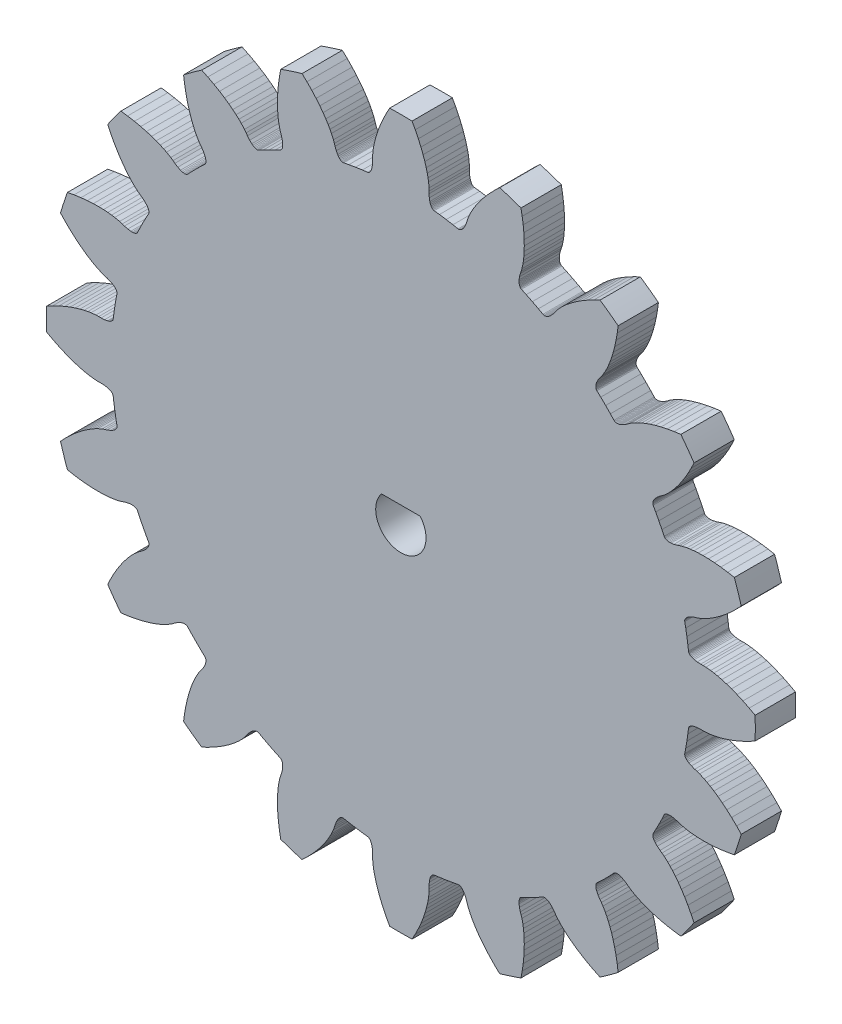
from build123d import *

# Parameters (mm, degrees)
MODEL_R             = 0.5
BOSS_EXTRUDE1_DEPTH = 5
CUT_EXTRUDE1_DEPTH  = 63.425869445
BOSS_EXTRUDE2_START = 10
SKETCH3_R           = 8
BOSS_EXTRUDE2_DEPTH = 10
SKETCH5_R           = 1.5
CUT_EXTRUDE2_DEPTH  = 10


with BuildPart() as part:
    # Model → Boss-Extrude1 (new body)
    with BuildSketch(Plane.XY):
        with BuildLine():
            Line((41.0580513, 11.0594647), (41.6786239, 11.6621942))
            Line((41.6786239, 11.6621942), (42.254799591, 12.268924064))
            ThreePointArc((42.254799591, 12.268924064), (41.846428175, 13.596728691), (41.396343585, 14.910979886))
            Line((41.396343585, 14.910979886), (40.5735808, 15.0631672))
            Line((40.5735808, 15.0631672), (39.7172515, 15.1860222))
            Line((39.7172515, 15.1860222), (38.9209581, 15.2664261))
            Line((38.9209581, 15.2664261), (38.188074, 15.3095207))
            Line((38.188074, 15.3095207), (37.5212498, 15.3207867))
            Line((37.5212498, 15.3207867), (36.9192091, 15.3057692))
            Line((36.9192091, 15.3057692), (36.385219, 15.2700607))
            Line((36.385219, 15.2700607), (35.9182805, 15.2191681))
            Line((35.9182805, 15.2191681), (35.519022, 15.1586865))
            Line((35.519022, 15.1586865), (34.9229912, 15.031255))
            Line((34.9229912, 15.031255), (34.5912709, 14.9315723))
            Line((34.5912709, 14.9315723), (34.3145829, 14.8346777))
            Line((34.3145829, 14.8346777), (33.8996768, 14.7245961))
            Line((33.8996768, 14.7245961), (33.5375203, 14.6729516))
            Line((33.5375203, 14.6729516), (33.3775076, 14.6675821))
            Line((33.3775076, 14.6675821), (33.232174, 14.6750343))
            Line((33.232174, 14.6750343), (33.1019936, 14.6947079))
            Line((33.1019936, 14.6947079), (32.9874095, 14.7259534))
            Line((32.9874095, 14.7259534), (32.8888203, 14.7681208))
            Line((32.8888203, 14.7681208), (32.8066469, 14.8205604))
            Line((32.8066469, 14.8205604), (32.74127, 14.8825908))
            Line((32.74127, 14.8825908), (32.6837041, 14.9725741))
            Line((32.6837041, 14.9725741), (32.4071065, 15.5624769))
            Line((32.4071065, 15.5624769), (32.0316845, 16.3209585))
            Line((32.0316845, 16.3209585), (31.6387276, 17.0705055))
            Line((31.6387276, 17.0705055), (31.3240661, 17.6410139))
            Line((31.3240661, 17.6410139), (31.2851045, 17.7404764))
            Line((31.2851045, 17.7404764), (31.2733484, 17.829828))
            Line((31.2733484, 17.829828), (31.2792242, 17.927131))
            Line((31.2792242, 17.927131), (31.3030593, 18.0316767))
            Line((31.3030593, 18.0316767), (31.345132, 18.1427428))
            Line((31.345132, 18.1427428), (31.4057339, 18.2596248))
            Line((31.4057339, 18.2596248), (31.48513, 18.3815824))
            Line((31.48513, 18.3815824), (31.583527, 18.5078793))
            Line((31.583527, 18.5078793), (31.8381786, 18.7705142))
            Line((31.8381786, 18.7705142), (32.1711122, 19.0414759))
            Line((32.1711122, 19.0414759), (32.4121346, 19.208368))
            Line((32.4121346, 19.208368), (32.6877599, 19.4181434))
            Line((32.6877599, 19.4181434), (33.1411923, 19.8254401))
            Line((33.1411923, 19.8254401), (33.4248012, 20.1128967))
            Line((33.4248012, 20.1128967), (33.7404338, 20.460744))
            Line((33.7404338, 20.460744), (34.083194, 20.8717622))
            Line((34.083194, 20.8717622), (34.4492141, 21.3499962))
            Line((34.4492141, 21.3499962), (34.8320491, 21.8960904))
            Line((34.8320491, 21.8960904), (35.2279633, 22.5143365))
            Line((35.2279633, 22.5143365), (35.6309647, 23.2058115))
            Line((35.6309647, 23.2058115), (36.0349107, 23.9708089))
            Line((36.0349107, 23.9708089), (36.395396459, 24.725891411))
            ThreePointArc((36.395396459, 24.725891411), (35.596697995, 25.862514918), (34.762516187, 26.973358268))
            Line((34.762516187, 26.973358268), (33.9329938, 26.8638493))
            Line((33.9329938, 26.8638493), (33.0806119, 26.716071))
            Line((33.0806119, 26.716071), (32.2984457, 26.5464715))
            Line((32.2984457, 26.5464715), (31.5881145, 26.3609832))
            Line((31.5881145, 26.3609832), (30.9504457, 26.1656379))
            Line((30.9504457, 26.1656379), (30.3825116, 25.9653146))
            Line((30.3825116, 25.9653146), (29.8856913, 25.7663418))
            Line((29.8856913, 25.7663418), (29.4573331, 25.5736481))
            Line((29.4573331, 25.5736481), (29.0963056, 25.392749))
            Line((29.0963056, 25.392749), (28.5688252, 25.0873708))
            Line((28.5688252, 25.0873708), (28.284144, 24.8900597))
            Line((28.284144, 24.8900597), (28.0509402, 24.7124062))
            Line((28.0509402, 24.7124062), (27.6903581, 24.4794994))
            Line((27.6903581, 24.4794994), (27.3618858, 24.3184699))
            Line((27.3618858, 24.3184699), (27.211364, 24.2639166))
            Line((27.211364, 24.2639166), (27.0708407, 24.2260935))
            Line((27.0708407, 24.2260935), (26.9409522, 24.2045762))
            Line((26.9409522, 24.2045762), (26.8223209, 24.198884))
            Line((26.8223209, 24.198884), (26.7155266, 24.2085219))
            Line((26.7155266, 24.2085219), (26.6211702, 24.2330019))
            Line((26.6211702, 24.2330019), (26.5398247, 24.2717938))
            Line((26.5398247, 24.2717938), (26.45727, 24.3395841))
            Line((26.45727, 24.3395841), (26.01192, 24.8151417))
            Line((26.01192, 24.8151417), (25.4204888, 25.4204888))
            Line((25.4204888, 25.4204888), (24.8151417, 26.01192))
            Line((24.8151417, 26.01192), (24.3395841, 26.45727))
            Line((24.3395841, 26.45727), (24.2717938, 26.5398247))
            Line((24.2717938, 26.5398247), (24.2330019, 26.6211702))
            Line((24.2330019, 26.6211702), (24.2085219, 26.7155266))
            Line((24.2085219, 26.7155266), (24.198884, 26.8223209))
            Line((24.198884, 26.8223209), (24.2045762, 26.9409522))
            Line((24.2045762, 26.9409522), (24.2260935, 27.0708407))
            Line((24.2260935, 27.0708407), (24.2639166, 27.211364))
            Line((24.2639166, 27.211364), (24.3184699, 27.3618858))
            Line((24.3184699, 27.3618858), (24.4794994, 27.6903581))
            Line((24.4794994, 27.6903581), (24.7124062, 28.0509402))
            Line((24.7124062, 28.0509402), (24.8900597, 28.284144))
            Line((24.8900597, 28.284144), (25.0873708, 28.5688252))
            Line((25.0873708, 28.5688252), (25.392749, 29.0963056))
            Line((25.392749, 29.0963056), (25.5736481, 29.4573331))
            Line((25.5736481, 29.4573331), (25.7663418, 29.8856913))
            Line((25.7663418, 29.8856913), (25.9653146, 30.3825116))
            Line((25.9653146, 30.3825116), (26.1656379, 30.9504457))
            Line((26.1656379, 30.9504457), (26.3609832, 31.5881145))
            Line((26.3609832, 31.5881145), (26.5464715, 32.2984457))
            Line((26.5464715, 32.2984457), (26.716071, 33.0806119))
            Line((26.716071, 33.0806119), (26.8638493, 33.9329938))
            Line((26.8638493, 33.9329938), (26.973358307, 34.762516234))
            ThreePointArc((26.973358307, 34.762516234), (25.862514956, 35.59669804), (24.725891448, 36.395396503))
            Line((24.725891448, 36.395396503), (23.9708089, 36.0349107))
            Line((23.9708089, 36.0349107), (23.2058115, 35.6309647))
            Line((23.2058115, 35.6309647), (22.5143365, 35.2279633))
            Line((22.5143365, 35.2279633), (21.8960904, 34.8320491))
            Line((21.8960904, 34.8320491), (21.3499962, 34.4492141))
            Line((21.3499962, 34.4492141), (20.8717622, 34.083194))
            Line((20.8717622, 34.083194), (20.460744, 33.7404338))
            Line((20.460744, 33.7404338), (20.1128967, 33.4248012))
            Line((20.1128967, 33.4248012), (19.8254401, 33.1411923))
            Line((19.8254401, 33.1411923), (19.4181434, 32.6877599))
            Line((19.4181434, 32.6877599), (19.208368, 32.4121346))
            Line((19.208368, 32.4121346), (19.0414759, 32.1711122))
            Line((19.0414759, 32.1711122), (18.7705142, 31.8381786))
            Line((18.7705142, 31.8381786), (18.5078793, 31.583527))
            Line((18.5078793, 31.583527), (18.3815824, 31.48513))
            Line((18.3815824, 31.48513), (18.2596248, 31.4057339))
            Line((18.2596248, 31.4057339), (18.1427428, 31.345132))
            Line((18.1427428, 31.345132), (18.0316767, 31.3030593))
            Line((18.0316767, 31.3030593), (17.927131, 31.2792242))
            Line((17.927131, 31.2792242), (17.829828, 31.2733484))
            Line((17.829828, 31.2733484), (17.7404764, 31.2851045))
            Line((17.7404764, 31.2851045), (17.6410139, 31.3240661))
            Line((17.6410139, 31.3240661), (17.0705055, 31.6387276))
            Line((17.0705055, 31.6387276), (16.3209585, 32.0316845))
            Line((16.3209585, 32.0316845), (15.5624769, 32.4071065))
            Line((15.5624769, 32.4071065), (14.9725741, 32.6837041))
            Line((14.9725741, 32.6837041), (14.8825908, 32.74127))
            Line((14.8825908, 32.74127), (14.8205604, 32.8066469))
            Line((14.8205604, 32.8066469), (14.7681208, 32.8888203))
            Line((14.7681208, 32.8888203), (14.7259534, 32.9874095))
            Line((14.7259534, 32.9874095), (14.6947079, 33.1019936))
            Line((14.6947079, 33.1019936), (14.6750343, 33.232174))
            Line((14.6750343, 33.232174), (14.6675821, 33.3775076))
            Line((14.6675821, 33.3775076), (14.6729516, 33.5375203))
            Line((14.6729516, 33.5375203), (14.7245961, 33.8996768))
            Line((14.7245961, 33.8996768), (14.8346777, 34.3145829))
            Line((14.8346777, 34.3145829), (14.9315723, 34.5912709))
            Line((14.9315723, 34.5912709), (15.031255, 34.9229912))
            Line((15.031255, 34.9229912), (15.1586865, 35.519022))
            Line((15.1586865, 35.519022), (15.2191681, 35.9182805))
            Line((15.2191681, 35.9182805), (15.2700607, 36.385219))
            Line((15.2700607, 36.385219), (15.3057692, 36.9192091))
            Line((15.3057692, 36.9192091), (15.3207867, 37.5212498))
            Line((15.3207867, 37.5212498), (15.3095207, 38.188074))
            Line((15.3095207, 38.188074), (15.2664261, 38.9209581))
            Line((15.2664261, 38.9209581), (15.1860222, 39.7172515))
            Line((15.1860222, 39.7172515), (15.0631672, 40.5735808))
            Line((15.0631672, 40.5735808), (14.910979886, 41.396343585))
            ThreePointArc((14.910979886, 41.396343585), (13.596728691, 41.846428175), (12.268924064, 42.254799591))
            Line((12.268924064, 42.254799591), (11.6621942, 41.6786239))
            Line((11.6621942, 41.6786239), (11.0594647, 41.0580513))
            Line((11.0594647, 41.0580513), (10.5263671, 40.4610966))
            Line((10.5263671, 40.4610966), (10.0607243, 39.8935113))
            Line((10.0607243, 39.8935113), (9.6596604, 39.3606612))
            Line((9.6596604, 39.3606612), (9.3179393, 38.864773))
            Line((9.3179393, 38.864773), (9.0329565, 38.411777))
            Line((9.0329565, 38.411777), (8.7996699, 38.0041019))
            Line((8.7996699, 38.0041019), (8.6139223, 37.6455448))
            Line((8.6139223, 37.6455448), (8.3666785, 37.0884434))
            Line((8.3666785, 37.0884434), (8.2523431, 36.761484))
            Line((8.2523431, 36.761484), (8.1680994, 36.4806855))
            Line((8.1680994, 36.4806855), (8.0132816, 36.0803151))
            Line((8.0132816, 36.0803151), (7.8421926, 35.7569684))
            Line((7.8421926, 35.7569684), (7.7524835, 35.6243594))
            Line((7.7524835, 35.6243594), (7.6610297, 35.5111623))
            Line((7.6610297, 35.5111623), (7.5685952, 35.4174079))
            Line((7.5685952, 35.4174079), (7.4759663, 35.3430731))
            Line((7.4759663, 35.3430731), (7.3839029, 35.2880982))
            Line((7.3839029, 35.2880982), (7.293178, 35.2524417))
            Line((7.293178, 35.2524417), (7.2045667, 35.2360112))
            Line((7.2045667, 35.2360112), (7.0979324, 35.2423303))
            Line((7.0979324, 35.2423303), (6.458111, 35.3652943))
            Line((6.458111, 35.3652943), (5.623819, 35.5073958))
            Line((5.623819, 35.5073958), (4.7864484, 35.6300597))
            Line((4.7864484, 35.6300597), (4.1399441, 35.7108296))
            Line((4.1399441, 35.7108296), (4.0365761, 35.7377716))
            Line((4.0365761, 35.7377716), (3.9573791, 35.7807803))
            Line((3.9573791, 35.7807803), (3.8821131, 35.8427272))
            Line((3.8821131, 35.8427272), (3.8115438, 35.9234606))
            Line((3.8115438, 35.9234606), (3.7464191, 36.0227811))
            Line((3.7464191, 36.0227811), (3.6874804, 36.1405106))
            Line((3.6874804, 36.1405106), (3.6354825, 36.2764283))
            Line((3.6354825, 36.2764283), (3.5911425, 36.4302686))
            Line((3.5911425, 36.4302686), (3.5283469, 36.790659))
            Line((3.5283469, 36.790659), (3.5048276, 37.2192752))
            Line((3.5048276, 37.2192752), (3.5114786, 37.5123632))
            Line((3.5114786, 37.5123632), (3.5037752, 37.8586516))
            Line((3.5037752, 37.8586516), (3.4407861, 38.4648891))
            Line((3.4407861, 38.4648891), (3.37493, 38.8632963))
            Line((3.37493, 38.8632963), (3.2790398, 39.3231079))
            Line((3.2790398, 39.3231079), (3.1479885, 39.8419972))
            Line((3.1479885, 39.8419972), (2.9762302, 40.4192126))
            Line((2.9762302, 40.4192126), (2.7594555, 41.0499187))
            Line((2.7594555, 41.0499187), (2.4919965, 41.7336159))
            Line((2.4919965, 41.7336159), (2.1694597, 42.4660898))
            Line((2.1694597, 42.4660898), (1.7879973, 43.2425431))
            Line((1.7879973, 43.2425431), (1.389010873, 43.978008589))
            ThreePointArc((1.389010873, 43.978008589), (-7.7e-08, 43.9999385), (-1.389011027, 43.978008585))
            Line((-1.389011027, 43.978008585), (-1.7879973, 43.2425431))
            Line((-1.7879973, 43.2425431), (-2.1694597, 42.4660898))
            Line((-2.1694597, 42.4660898), (-2.4919965, 41.7336159))
            Line((-2.4919965, 41.7336159), (-2.7594555, 41.0499187))
            Line((-2.7594555, 41.0499187), (-2.9762302, 40.4192126))
            Line((-2.9762302, 40.4192126), (-3.1479885, 39.8419972))
            Line((-3.1479885, 39.8419972), (-3.2790398, 39.3231079))
            Line((-3.2790398, 39.3231079), (-3.37493, 38.8632963))
            Line((-3.37493, 38.8632963), (-3.4407861, 38.4648891))
            Line((-3.4407861, 38.4648891), (-3.5037752, 37.8586516))
            Line((-3.5037752, 37.8586516), (-3.5114786, 37.5123632))
            Line((-3.5114786, 37.5123632), (-3.5048276, 37.2192752))
            Line((-3.5048276, 37.2192752), (-3.5283469, 36.790659))
            Line((-3.5283469, 36.790659), (-3.5911425, 36.4302686))
            Line((-3.5911425, 36.4302686), (-3.6354825, 36.2764283))
            Line((-3.6354825, 36.2764283), (-3.6874804, 36.1405106))
            Line((-3.6874804, 36.1405106), (-3.7464191, 36.0227811))
            Line((-3.7464191, 36.0227811), (-3.8115438, 35.9234606))
            Line((-3.8115438, 35.9234606), (-3.8821131, 35.8427272))
            Line((-3.8821131, 35.8427272), (-3.9573791, 35.7807803))
            Line((-3.9573791, 35.7807803), (-4.0365761, 35.7377716))
            Line((-4.0365761, 35.7377716), (-4.1399441, 35.7108296))
            Line((-4.1399441, 35.7108296), (-4.7864484, 35.6300597))
            Line((-4.7864484, 35.6300597), (-5.623819, 35.5073958))
            Line((-5.623819, 35.5073958), (-6.458111, 35.3652943))
            Line((-6.458111, 35.3652943), (-7.0979324, 35.2423303))
            Line((-7.0979324, 35.2423303), (-7.2045667, 35.2360112))
            Line((-7.2045667, 35.2360112), (-7.293178, 35.2524417))
            Line((-7.293178, 35.2524417), (-7.3839029, 35.2880982))
            Line((-7.3839029, 35.2880982), (-7.4759663, 35.3430731))
            Line((-7.4759663, 35.3430731), (-7.5685952, 35.4174079))
            Line((-7.5685952, 35.4174079), (-7.6610297, 35.5111623))
            Line((-7.6610297, 35.5111623), (-7.7524835, 35.6243594))
            Line((-7.7524835, 35.6243594), (-7.8421926, 35.7569684))
            Line((-7.8421926, 35.7569684), (-8.0132816, 36.0803151))
            Line((-8.0132816, 36.0803151), (-8.1680994, 36.4806855))
            Line((-8.1680994, 36.4806855), (-8.2523431, 36.761484))
            Line((-8.2523431, 36.761484), (-8.3666785, 37.0884434))
            Line((-8.3666785, 37.0884434), (-8.6139223, 37.6455448))
            Line((-8.6139223, 37.6455448), (-8.7996699, 38.0041019))
            Line((-8.7996699, 38.0041019), (-9.0329565, 38.411777))
            Line((-9.0329565, 38.411777), (-9.3179393, 38.864773))
            Line((-9.3179393, 38.864773), (-9.6596604, 39.3606612))
            Line((-9.6596604, 39.3606612), (-10.0607243, 39.8935113))
            Line((-10.0607243, 39.8935113), (-10.5263671, 40.4610966))
            Line((-10.5263671, 40.4610966), (-11.0594647, 41.0580513))
            Line((-11.0594647, 41.0580513), (-11.6621942, 41.6786239))
            Line((-11.6621942, 41.6786239), (-12.268924064, 42.254799591))
            ThreePointArc((-12.268924064, 42.254799591), (-13.596728691, 41.846428175), (-14.910979886, 41.396343585))
            Line((-14.910979886, 41.396343585), (-15.0631672, 40.5735808))
            Line((-15.0631672, 40.5735808), (-15.1860222, 39.7172515))
            Line((-15.1860222, 39.7172515), (-15.2664261, 38.9209581))
            Line((-15.2664261, 38.9209581), (-15.3095207, 38.188074))
            Line((-15.3095207, 38.188074), (-15.3207867, 37.5212498))
            Line((-15.3207867, 37.5212498), (-15.3057692, 36.9192091))
            Line((-15.3057692, 36.9192091), (-15.2700607, 36.385219))
            Line((-15.2700607, 36.385219), (-15.2191681, 35.9182805))
            Line((-15.2191681, 35.9182805), (-15.1586865, 35.519022))
            Line((-15.1586865, 35.519022), (-15.031255, 34.9229912))
            Line((-15.031255, 34.9229912), (-14.9315723, 34.5912709))
            Line((-14.9315723, 34.5912709), (-14.8346777, 34.3145829))
            Line((-14.8346777, 34.3145829), (-14.7245961, 33.8996768))
            Line((-14.7245961, 33.8996768), (-14.6729516, 33.5375203))
            Line((-14.6729516, 33.5375203), (-14.6675821, 33.3775076))
            Line((-14.6675821, 33.3775076), (-14.6750343, 33.232174))
            Line((-14.6750343, 33.232174), (-14.6947079, 33.1019936))
            Line((-14.6947079, 33.1019936), (-14.7259534, 32.9874095))
            Line((-14.7259534, 32.9874095), (-14.7681208, 32.8888203))
            Line((-14.7681208, 32.8888203), (-14.8205604, 32.8066469))
            Line((-14.8205604, 32.8066469), (-14.8825908, 32.74127))
            Line((-14.8825908, 32.74127), (-14.9725741, 32.6837041))
            Line((-14.9725741, 32.6837041), (-15.5624769, 32.4071065))
            Line((-15.5624769, 32.4071065), (-16.3209585, 32.0316845))
            Line((-16.3209585, 32.0316845), (-17.0705055, 31.6387276))
            Line((-17.0705055, 31.6387276), (-17.6410139, 31.3240661))
            Line((-17.6410139, 31.3240661), (-17.7404764, 31.2851045))
            Line((-17.7404764, 31.2851045), (-17.829828, 31.2733484))
            Line((-17.829828, 31.2733484), (-17.927131, 31.2792242))
            Line((-17.927131, 31.2792242), (-18.0316767, 31.3030593))
            Line((-18.0316767, 31.3030593), (-18.1427428, 31.345132))
            Line((-18.1427428, 31.345132), (-18.2596248, 31.4057339))
            Line((-18.2596248, 31.4057339), (-18.3815824, 31.48513))
            Line((-18.3815824, 31.48513), (-18.5078793, 31.583527))
            Line((-18.5078793, 31.583527), (-18.7705142, 31.8381786))
            Line((-18.7705142, 31.8381786), (-19.0414759, 32.1711122))
            Line((-19.0414759, 32.1711122), (-19.208368, 32.4121346))
            Line((-19.208368, 32.4121346), (-19.4181434, 32.6877599))
            Line((-19.4181434, 32.6877599), (-19.8254401, 33.1411923))
            Line((-19.8254401, 33.1411923), (-20.1128967, 33.4248012))
            Line((-20.1128967, 33.4248012), (-20.460744, 33.7404338))
            Line((-20.460744, 33.7404338), (-20.8717622, 34.083194))
            Line((-20.8717622, 34.083194), (-21.3499962, 34.4492141))
            Line((-21.3499962, 34.4492141), (-21.8960904, 34.8320491))
            Line((-21.8960904, 34.8320491), (-22.5143365, 35.2279633))
            Line((-22.5143365, 35.2279633), (-23.2058115, 35.6309647))
            Line((-23.2058115, 35.6309647), (-23.9708089, 36.0349107))
            Line((-23.9708089, 36.0349107), (-24.725891411, 36.395396459))
            ThreePointArc((-24.725891411, 36.395396459), (-25.862514918, 35.596697995), (-26.973358268, 34.762516187))
            Line((-26.973358268, 34.762516187), (-26.8638493, 33.9329938))
            Line((-26.8638493, 33.9329938), (-26.716071, 33.0806119))
            Line((-26.716071, 33.0806119), (-26.5464715, 32.2984457))
            Line((-26.5464715, 32.2984457), (-26.3609832, 31.5881145))
            Line((-26.3609832, 31.5881145), (-26.1656379, 30.9504457))
            Line((-26.1656379, 30.9504457), (-25.9653146, 30.3825116))
            Line((-25.9653146, 30.3825116), (-25.7663418, 29.8856913))
            Line((-25.7663418, 29.8856913), (-25.5736481, 29.4573331))
            Line((-25.5736481, 29.4573331), (-25.392749, 29.0963056))
            Line((-25.392749, 29.0963056), (-25.0873708, 28.5688252))
            Line((-25.0873708, 28.5688252), (-24.8900597, 28.284144))
            Line((-24.8900597, 28.284144), (-24.7124062, 28.0509402))
            Line((-24.7124062, 28.0509402), (-24.4794994, 27.6903581))
            Line((-24.4794994, 27.6903581), (-24.3184699, 27.3618858))
            Line((-24.3184699, 27.3618858), (-24.2639166, 27.211364))
            Line((-24.2639166, 27.211364), (-24.2260935, 27.0708407))
            Line((-24.2260935, 27.0708407), (-24.2045762, 26.9409522))
            Line((-24.2045762, 26.9409522), (-24.198884, 26.8223209))
            Line((-24.198884, 26.8223209), (-24.2085219, 26.7155266))
            Line((-24.2085219, 26.7155266), (-24.2330019, 26.6211702))
            Line((-24.2330019, 26.6211702), (-24.2717938, 26.5398247))
            Line((-24.2717938, 26.5398247), (-24.3395841, 26.45727))
            Line((-24.3395841, 26.45727), (-24.8151417, 26.01192))
            Line((-24.8151417, 26.01192), (-25.4204888, 25.4204888))
            Line((-25.4204888, 25.4204888), (-26.01192, 24.8151417))
            Line((-26.01192, 24.8151417), (-26.45727, 24.3395841))
            Line((-26.45727, 24.3395841), (-26.5398247, 24.2717938))
            Line((-26.5398247, 24.2717938), (-26.6211702, 24.2330019))
            Line((-26.6211702, 24.2330019), (-26.7155266, 24.2085219))
            Line((-26.7155266, 24.2085219), (-26.8223209, 24.198884))
            Line((-26.8223209, 24.198884), (-26.9409522, 24.2045762))
            Line((-26.9409522, 24.2045762), (-27.0708407, 24.2260935))
            Line((-27.0708407, 24.2260935), (-27.211364, 24.2639166))
            Line((-27.211364, 24.2639166), (-27.3618858, 24.3184699))
            Line((-27.3618858, 24.3184699), (-27.6903581, 24.4794994))
            Line((-27.6903581, 24.4794994), (-28.0509402, 24.7124062))
            Line((-28.0509402, 24.7124062), (-28.284144, 24.8900597))
            Line((-28.284144, 24.8900597), (-28.5688252, 25.0873708))
            Line((-28.5688252, 25.0873708), (-29.0963056, 25.392749))
            Line((-29.0963056, 25.392749), (-29.4573331, 25.5736481))
            Line((-29.4573331, 25.5736481), (-29.8856913, 25.7663418))
            Line((-29.8856913, 25.7663418), (-30.3825116, 25.9653146))
            Line((-30.3825116, 25.9653146), (-30.9504457, 26.1656379))
            Line((-30.9504457, 26.1656379), (-31.5881145, 26.3609832))
            Line((-31.5881145, 26.3609832), (-32.2984457, 26.5464715))
            Line((-32.2984457, 26.5464715), (-33.0806119, 26.716071))
            Line((-33.0806119, 26.716071), (-33.9329938, 26.8638493))
            Line((-33.9329938, 26.8638493), (-34.762516234, 26.973358307))
            ThreePointArc((-34.762516234, 26.973358307), (-35.59669804, 25.862514956), (-36.395396503, 24.725891448))
            Line((-36.395396503, 24.725891448), (-36.0349107, 23.9708089))
            Line((-36.0349107, 23.9708089), (-35.6309647, 23.2058115))
            Line((-35.6309647, 23.2058115), (-35.2279633, 22.5143365))
            Line((-35.2279633, 22.5143365), (-34.8320491, 21.8960904))
            Line((-34.8320491, 21.8960904), (-34.4492141, 21.3499962))
            Line((-34.4492141, 21.3499962), (-34.083194, 20.8717622))
            Line((-34.083194, 20.8717622), (-33.7404338, 20.460744))
            Line((-33.7404338, 20.460744), (-33.4248012, 20.1128967))
            Line((-33.4248012, 20.1128967), (-33.1411923, 19.8254401))
            Line((-33.1411923, 19.8254401), (-32.6877599, 19.4181434))
            Line((-32.6877599, 19.4181434), (-32.4121346, 19.208368))
            Line((-32.4121346, 19.208368), (-32.1711122, 19.0414759))
            Line((-32.1711122, 19.0414759), (-31.8381786, 18.7705142))
            Line((-31.8381786, 18.7705142), (-31.583527, 18.5078793))
            Line((-31.583527, 18.5078793), (-31.48513, 18.3815824))
            Line((-31.48513, 18.3815824), (-31.4057339, 18.2596248))
            Line((-31.4057339, 18.2596248), (-31.345132, 18.1427428))
            Line((-31.345132, 18.1427428), (-31.3030593, 18.0316767))
            Line((-31.3030593, 18.0316767), (-31.2792242, 17.927131))
            Line((-31.2792242, 17.927131), (-31.2733484, 17.829828))
            Line((-31.2733484, 17.829828), (-31.2851045, 17.7404764))
            Line((-31.2851045, 17.7404764), (-31.3240661, 17.6410139))
            Line((-31.3240661, 17.6410139), (-31.6387276, 17.0705055))
            Line((-31.6387276, 17.0705055), (-32.0316845, 16.3209585))
            Line((-32.0316845, 16.3209585), (-32.4071065, 15.5624769))
            Line((-32.4071065, 15.5624769), (-32.6837041, 14.9725741))
            Line((-32.6837041, 14.9725741), (-32.74127, 14.8825908))
            Line((-32.74127, 14.8825908), (-32.8066469, 14.8205604))
            Line((-32.8066469, 14.8205604), (-32.8888203, 14.7681208))
            Line((-32.8888203, 14.7681208), (-32.9874095, 14.7259534))
            Line((-32.9874095, 14.7259534), (-33.1019936, 14.6947079))
            Line((-33.1019936, 14.6947079), (-33.232174, 14.6750343))
            Line((-33.232174, 14.6750343), (-33.3775076, 14.6675821))
            Line((-33.3775076, 14.6675821), (-33.5375203, 14.6729516))
            Line((-33.5375203, 14.6729516), (-33.8996768, 14.7245961))
            Line((-33.8996768, 14.7245961), (-34.3145829, 14.8346777))
            Line((-34.3145829, 14.8346777), (-34.5912709, 14.9315723))
            Line((-34.5912709, 14.9315723), (-34.9229912, 15.031255))
            Line((-34.9229912, 15.031255), (-35.519022, 15.1586865))
            Line((-35.519022, 15.1586865), (-35.9182805, 15.2191681))
            Line((-35.9182805, 15.2191681), (-36.385219, 15.2700607))
            Line((-36.385219, 15.2700607), (-36.9192091, 15.3057692))
            Line((-36.9192091, 15.3057692), (-37.5212498, 15.3207867))
            Line((-37.5212498, 15.3207867), (-38.188074, 15.3095207))
            Line((-38.188074, 15.3095207), (-38.9209581, 15.2664261))
            Line((-38.9209581, 15.2664261), (-39.7172515, 15.1860222))
            Line((-39.7172515, 15.1860222), (-40.5735808, 15.0631672))
            Line((-40.5735808, 15.0631672), (-41.396343585, 14.910979886))
            ThreePointArc((-41.396343585, 14.910979886), (-41.846428175, 13.596728691), (-42.254799591, 12.268924064))
            Line((-42.254799591, 12.268924064), (-41.6786239, 11.6621942))
            Line((-41.6786239, 11.6621942), (-41.0580513, 11.0594647))
            Line((-41.0580513, 11.0594647), (-40.4610966, 10.5263671))
            Line((-40.4610966, 10.5263671), (-39.8935113, 10.0607243))
            Line((-39.8935113, 10.0607243), (-39.3606612, 9.6596604))
            Line((-39.3606612, 9.6596604), (-38.864773, 9.3179393))
            Line((-38.864773, 9.3179393), (-38.411777, 9.0329565))
            Line((-38.411777, 9.0329565), (-38.0041019, 8.7996699))
            Line((-38.0041019, 8.7996699), (-37.6455448, 8.6139223))
            Line((-37.6455448, 8.6139223), (-37.0884434, 8.3666785))
            Line((-37.0884434, 8.3666785), (-36.761484, 8.2523431))
            Line((-36.761484, 8.2523431), (-36.4806855, 8.1680994))
            Line((-36.4806855, 8.1680994), (-36.0803151, 8.0132816))
            Line((-36.0803151, 8.0132816), (-35.7569684, 7.8421926))
            Line((-35.7569684, 7.8421926), (-35.6243594, 7.7524835))
            Line((-35.6243594, 7.7524835), (-35.5111623, 7.6610297))
            Line((-35.5111623, 7.6610297), (-35.4174079, 7.5685952))
            Line((-35.4174079, 7.5685952), (-35.3430731, 7.4759663))
            Line((-35.3430731, 7.4759663), (-35.2880982, 7.3839029))
            Line((-35.2880982, 7.3839029), (-35.2524417, 7.293178))
            Line((-35.2524417, 7.293178), (-35.2360112, 7.2045667))
            Line((-35.2360112, 7.2045667), (-35.2423303, 7.0979324))
            Line((-35.2423303, 7.0979324), (-35.3652943, 6.458111))
            Line((-35.3652943, 6.458111), (-35.5073958, 5.623819))
            Line((-35.5073958, 5.623819), (-35.6300597, 4.7864484))
            Line((-35.6300597, 4.7864484), (-35.7108296, 4.1399441))
            Line((-35.7108296, 4.1399441), (-35.7377716, 4.0365761))
            Line((-35.7377716, 4.0365761), (-35.7807803, 3.9573791))
            Line((-35.7807803, 3.9573791), (-35.8427272, 3.8821131))
            Line((-35.8427272, 3.8821131), (-35.9234606, 3.8115438))
            Line((-35.9234606, 3.8115438), (-36.0227811, 3.7464191))
            Line((-36.0227811, 3.7464191), (-36.1405106, 3.6874804))
            Line((-36.1405106, 3.6874804), (-36.2764283, 3.6354825))
            Line((-36.2764283, 3.6354825), (-36.4302686, 3.5911425))
            Line((-36.4302686, 3.5911425), (-36.790659, 3.5283469))
            Line((-36.790659, 3.5283469), (-37.2192752, 3.5048276))
            Line((-37.2192752, 3.5048276), (-37.5123632, 3.5114786))
            Line((-37.5123632, 3.5114786), (-37.8586516, 3.5037752))
            Line((-37.8586516, 3.5037752), (-38.4648891, 3.4407861))
            Line((-38.4648891, 3.4407861), (-38.8632963, 3.37493))
            Line((-38.8632963, 3.37493), (-39.3231079, 3.2790398))
            Line((-39.3231079, 3.2790398), (-39.8419972, 3.1479885))
            Line((-39.8419972, 3.1479885), (-40.4192126, 2.9762302))
            Line((-40.4192126, 2.9762302), (-41.0499187, 2.7594555))
            Line((-41.0499187, 2.7594555), (-41.7336159, 2.4919965))
            Line((-41.7336159, 2.4919965), (-42.4660898, 2.1694597))
            Line((-42.4660898, 2.1694597), (-43.2425431, 1.7879973))
            Line((-43.2425431, 1.7879973), (-43.978008589, 1.389010873))
            ThreePointArc((-43.978008589, 1.389010873), (-43.9999385, -7.7e-08), (-43.978008585, -1.389011027))
            Line((-43.978008585, -1.389011027), (-43.2425431, -1.7879973))
            Line((-43.2425431, -1.7879973), (-42.4660898, -2.1694597))
            Line((-42.4660898, -2.1694597), (-41.7336159, -2.4919965))
            Line((-41.7336159, -2.4919965), (-41.0499187, -2.7594555))
            Line((-41.0499187, -2.7594555), (-40.4192126, -2.9762302))
            Line((-40.4192126, -2.9762302), (-39.8419972, -3.1479885))
            Line((-39.8419972, -3.1479885), (-39.3231079, -3.2790398))
            Line((-39.3231079, -3.2790398), (-38.8632963, -3.37493))
            Line((-38.8632963, -3.37493), (-38.4648891, -3.4407861))
            Line((-38.4648891, -3.4407861), (-37.8586516, -3.5037752))
            Line((-37.8586516, -3.5037752), (-37.5123632, -3.5114786))
            Line((-37.5123632, -3.5114786), (-37.2192752, -3.5048276))
            Line((-37.2192752, -3.5048276), (-36.790659, -3.5283469))
            Line((-36.790659, -3.5283469), (-36.4302686, -3.5911425))
            Line((-36.4302686, -3.5911425), (-36.2764283, -3.6354825))
            Line((-36.2764283, -3.6354825), (-36.1405106, -3.6874804))
            Line((-36.1405106, -3.6874804), (-36.0227811, -3.7464191))
            Line((-36.0227811, -3.7464191), (-35.9234606, -3.8115438))
            Line((-35.9234606, -3.8115438), (-35.8427272, -3.8821131))
            Line((-35.8427272, -3.8821131), (-35.7807803, -3.9573791))
            Line((-35.7807803, -3.9573791), (-35.7377716, -4.0365761))
            Line((-35.7377716, -4.0365761), (-35.7108296, -4.1399441))
            Line((-35.7108296, -4.1399441), (-35.6300597, -4.7864484))
            Line((-35.6300597, -4.7864484), (-35.5073958, -5.623819))
            Line((-35.5073958, -5.623819), (-35.3652943, -6.458111))
            Line((-35.3652943, -6.458111), (-35.2423303, -7.0979324))
            Line((-35.2423303, -7.0979324), (-35.2360112, -7.2045667))
            Line((-35.2360112, -7.2045667), (-35.2524417, -7.293178))
            Line((-35.2524417, -7.293178), (-35.2880982, -7.3839029))
            Line((-35.2880982, -7.3839029), (-35.3430731, -7.4759663))
            Line((-35.3430731, -7.4759663), (-35.4174079, -7.5685952))
            Line((-35.4174079, -7.5685952), (-35.5111623, -7.6610297))
            Line((-35.5111623, -7.6610297), (-35.6243594, -7.7524835))
            Line((-35.6243594, -7.7524835), (-35.7569684, -7.8421926))
            Line((-35.7569684, -7.8421926), (-36.0803151, -8.0132816))
            Line((-36.0803151, -8.0132816), (-36.4806855, -8.1680994))
            Line((-36.4806855, -8.1680994), (-36.761484, -8.2523431))
            Line((-36.761484, -8.2523431), (-37.0884434, -8.3666785))
            Line((-37.0884434, -8.3666785), (-37.6455448, -8.6139223))
            Line((-37.6455448, -8.6139223), (-38.0041019, -8.7996699))
            Line((-38.0041019, -8.7996699), (-38.411777, -9.0329565))
            Line((-38.411777, -9.0329565), (-38.864773, -9.3179393))
            Line((-38.864773, -9.3179393), (-39.3606612, -9.6596604))
            Line((-39.3606612, -9.6596604), (-39.8935113, -10.0607243))
            Line((-39.8935113, -10.0607243), (-40.4610966, -10.5263671))
            Line((-40.4610966, -10.5263671), (-41.0580513, -11.0594647))
            Line((-41.0580513, -11.0594647), (-41.6786239, -11.6621942))
            Line((-41.6786239, -11.6621942), (-42.254799591, -12.268924064))
            ThreePointArc((-42.254799591, -12.268924064), (-41.846428175, -13.596728691), (-41.396343585, -14.910979886))
            Line((-41.396343585, -14.910979886), (-40.5735808, -15.0631672))
            Line((-40.5735808, -15.0631672), (-39.7172515, -15.1860222))
            Line((-39.7172515, -15.1860222), (-38.9209581, -15.2664261))
            Line((-38.9209581, -15.2664261), (-38.188074, -15.3095207))
            Line((-38.188074, -15.3095207), (-37.5212498, -15.3207867))
            Line((-37.5212498, -15.3207867), (-36.9192091, -15.3057692))
            Line((-36.9192091, -15.3057692), (-36.385219, -15.2700607))
            Line((-36.385219, -15.2700607), (-35.9182805, -15.2191681))
            Line((-35.9182805, -15.2191681), (-35.519022, -15.1586865))
            Line((-35.519022, -15.1586865), (-34.9229912, -15.031255))
            Line((-34.9229912, -15.031255), (-34.5912709, -14.9315723))
            Line((-34.5912709, -14.9315723), (-34.3145829, -14.8346777))
            Line((-34.3145829, -14.8346777), (-33.8996768, -14.7245961))
            Line((-33.8996768, -14.7245961), (-33.5375203, -14.6729516))
            Line((-33.5375203, -14.6729516), (-33.3775076, -14.6675821))
            Line((-33.3775076, -14.6675821), (-33.232174, -14.6750343))
            Line((-33.232174, -14.6750343), (-33.1019936, -14.6947079))
            Line((-33.1019936, -14.6947079), (-32.9874095, -14.7259534))
            Line((-32.9874095, -14.7259534), (-32.8888203, -14.7681208))
            Line((-32.8888203, -14.7681208), (-32.8066469, -14.8205604))
            Line((-32.8066469, -14.8205604), (-32.74127, -14.8825908))
            Line((-32.74127, -14.8825908), (-32.6837041, -14.9725741))
            Line((-32.6837041, -14.9725741), (-32.4071065, -15.5624769))
            Line((-32.4071065, -15.5624769), (-32.0316845, -16.3209585))
            Line((-32.0316845, -16.3209585), (-31.6387276, -17.0705055))
            Line((-31.6387276, -17.0705055), (-31.3240661, -17.6410139))
            Line((-31.3240661, -17.6410139), (-31.2851045, -17.7404764))
            Line((-31.2851045, -17.7404764), (-31.2733484, -17.829828))
            Line((-31.2733484, -17.829828), (-31.2792242, -17.927131))
            Line((-31.2792242, -17.927131), (-31.3030593, -18.0316767))
            Line((-31.3030593, -18.0316767), (-31.345132, -18.1427428))
            Line((-31.345132, -18.1427428), (-31.4057339, -18.2596248))
            Line((-31.4057339, -18.2596248), (-31.48513, -18.3815824))
            Line((-31.48513, -18.3815824), (-31.583527, -18.5078793))
            Line((-31.583527, -18.5078793), (-31.8381786, -18.7705142))
            Line((-31.8381786, -18.7705142), (-32.1711122, -19.0414759))
            Line((-32.1711122, -19.0414759), (-32.4121346, -19.208368))
            Line((-32.4121346, -19.208368), (-32.6877599, -19.4181434))
            Line((-32.6877599, -19.4181434), (-33.1411923, -19.8254401))
            Line((-33.1411923, -19.8254401), (-33.4248012, -20.1128967))
            Line((-33.4248012, -20.1128967), (-33.7404338, -20.460744))
            Line((-33.7404338, -20.460744), (-34.083194, -20.8717622))
            Line((-34.083194, -20.8717622), (-34.4492141, -21.3499962))
            Line((-34.4492141, -21.3499962), (-34.8320491, -21.8960904))
            Line((-34.8320491, -21.8960904), (-35.2279633, -22.5143365))
            Line((-35.2279633, -22.5143365), (-35.6309647, -23.2058115))
            Line((-35.6309647, -23.2058115), (-36.0349107, -23.9708089))
            Line((-36.0349107, -23.9708089), (-36.395396459, -24.725891411))
            ThreePointArc((-36.395396459, -24.725891411), (-35.596697995, -25.862514918), (-34.762516187, -26.973358268))
            Line((-34.762516187, -26.973358268), (-33.9329938, -26.8638493))
            Line((-33.9329938, -26.8638493), (-33.0806119, -26.716071))
            Line((-33.0806119, -26.716071), (-32.2984457, -26.5464715))
            Line((-32.2984457, -26.5464715), (-31.5881145, -26.3609832))
            Line((-31.5881145, -26.3609832), (-30.9504457, -26.1656379))
            Line((-30.9504457, -26.1656379), (-30.3825116, -25.9653146))
            Line((-30.3825116, -25.9653146), (-29.8856913, -25.7663418))
            Line((-29.8856913, -25.7663418), (-29.4573331, -25.5736481))
            Line((-29.4573331, -25.5736481), (-29.0963056, -25.392749))
            Line((-29.0963056, -25.392749), (-28.5688252, -25.0873708))
            Line((-28.5688252, -25.0873708), (-28.284144, -24.8900597))
            Line((-28.284144, -24.8900597), (-28.0509402, -24.7124062))
            Line((-28.0509402, -24.7124062), (-27.6903581, -24.4794994))
            Line((-27.6903581, -24.4794994), (-27.3618858, -24.3184699))
            Line((-27.3618858, -24.3184699), (-27.211364, -24.2639166))
            Line((-27.211364, -24.2639166), (-27.0708407, -24.2260935))
            Line((-27.0708407, -24.2260935), (-26.9409522, -24.2045762))
            Line((-26.9409522, -24.2045762), (-26.8223209, -24.198884))
            Line((-26.8223209, -24.198884), (-26.7155266, -24.2085219))
            Line((-26.7155266, -24.2085219), (-26.6211702, -24.2330019))
            Line((-26.6211702, -24.2330019), (-26.5398247, -24.2717938))
            Line((-26.5398247, -24.2717938), (-26.45727, -24.3395841))
            Line((-26.45727, -24.3395841), (-26.01192, -24.8151417))
            Line((-26.01192, -24.8151417), (-25.4204888, -25.4204888))
            Line((-25.4204888, -25.4204888), (-24.8151417, -26.01192))
            Line((-24.8151417, -26.01192), (-24.3395841, -26.45727))
            Line((-24.3395841, -26.45727), (-24.2717938, -26.5398247))
            Line((-24.2717938, -26.5398247), (-24.2330019, -26.6211702))
            Line((-24.2330019, -26.6211702), (-24.2085219, -26.7155266))
            Line((-24.2085219, -26.7155266), (-24.198884, -26.8223209))
            Line((-24.198884, -26.8223209), (-24.2045762, -26.9409522))
            Line((-24.2045762, -26.9409522), (-24.2260935, -27.0708407))
            Line((-24.2260935, -27.0708407), (-24.2639166, -27.211364))
            Line((-24.2639166, -27.211364), (-24.3184699, -27.3618858))
            Line((-24.3184699, -27.3618858), (-24.4794994, -27.6903581))
            Line((-24.4794994, -27.6903581), (-24.7124062, -28.0509402))
            Line((-24.7124062, -28.0509402), (-24.8900597, -28.284144))
            Line((-24.8900597, -28.284144), (-25.0873708, -28.5688252))
            Line((-25.0873708, -28.5688252), (-25.392749, -29.0963056))
            Line((-25.392749, -29.0963056), (-25.5736481, -29.4573331))
            Line((-25.5736481, -29.4573331), (-25.7663418, -29.8856913))
            Line((-25.7663418, -29.8856913), (-25.9653146, -30.3825116))
            Line((-25.9653146, -30.3825116), (-26.1656379, -30.9504457))
            Line((-26.1656379, -30.9504457), (-26.3609832, -31.5881145))
            Line((-26.3609832, -31.5881145), (-26.5464715, -32.2984457))
            Line((-26.5464715, -32.2984457), (-26.716071, -33.0806119))
            Line((-26.716071, -33.0806119), (-26.8638493, -33.9329938))
            Line((-26.8638493, -33.9329938), (-26.973358307, -34.762516234))
            ThreePointArc((-26.973358307, -34.762516234), (-25.862514956, -35.59669804), (-24.725891448, -36.395396503))
            Line((-24.725891448, -36.395396503), (-23.9708089, -36.0349107))
            Line((-23.9708089, -36.0349107), (-23.2058115, -35.6309647))
            Line((-23.2058115, -35.6309647), (-22.5143365, -35.2279633))
            Line((-22.5143365, -35.2279633), (-21.8960904, -34.8320491))
            Line((-21.8960904, -34.8320491), (-21.3499962, -34.4492141))
            Line((-21.3499962, -34.4492141), (-20.8717622, -34.083194))
            Line((-20.8717622, -34.083194), (-20.460744, -33.7404338))
            Line((-20.460744, -33.7404338), (-20.1128967, -33.4248012))
            Line((-20.1128967, -33.4248012), (-19.8254401, -33.1411923))
            Line((-19.8254401, -33.1411923), (-19.4181434, -32.6877599))
            Line((-19.4181434, -32.6877599), (-19.208368, -32.4121346))
            Line((-19.208368, -32.4121346), (-19.0414759, -32.1711122))
            Line((-19.0414759, -32.1711122), (-18.7705142, -31.8381786))
            Line((-18.7705142, -31.8381786), (-18.5078793, -31.583527))
            Line((-18.5078793, -31.583527), (-18.3815824, -31.48513))
            Line((-18.3815824, -31.48513), (-18.2596248, -31.4057339))
            Line((-18.2596248, -31.4057339), (-18.1427428, -31.345132))
            Line((-18.1427428, -31.345132), (-18.0316767, -31.3030593))
            Line((-18.0316767, -31.3030593), (-17.927131, -31.2792242))
            Line((-17.927131, -31.2792242), (-17.829828, -31.2733484))
            Line((-17.829828, -31.2733484), (-17.7404764, -31.2851045))
            Line((-17.7404764, -31.2851045), (-17.6410139, -31.3240661))
            Line((-17.6410139, -31.3240661), (-17.0705055, -31.6387276))
            Line((-17.0705055, -31.6387276), (-16.3209585, -32.0316845))
            Line((-16.3209585, -32.0316845), (-15.5624769, -32.4071065))
            Line((-15.5624769, -32.4071065), (-14.9725741, -32.6837041))
            Line((-14.9725741, -32.6837041), (-14.8825908, -32.74127))
            Line((-14.8825908, -32.74127), (-14.8205604, -32.8066469))
            Line((-14.8205604, -32.8066469), (-14.7681208, -32.8888203))
            Line((-14.7681208, -32.8888203), (-14.7259534, -32.9874095))
            Line((-14.7259534, -32.9874095), (-14.6947079, -33.1019936))
            Line((-14.6947079, -33.1019936), (-14.6750343, -33.232174))
            Line((-14.6750343, -33.232174), (-14.6675821, -33.3775076))
            Line((-14.6675821, -33.3775076), (-14.6729516, -33.5375203))
            Line((-14.6729516, -33.5375203), (-14.7245961, -33.8996768))
            Line((-14.7245961, -33.8996768), (-14.8346777, -34.3145829))
            Line((-14.8346777, -34.3145829), (-14.9315723, -34.5912709))
            Line((-14.9315723, -34.5912709), (-15.031255, -34.9229912))
            Line((-15.031255, -34.9229912), (-15.1586865, -35.519022))
            Line((-15.1586865, -35.519022), (-15.2191681, -35.9182805))
            Line((-15.2191681, -35.9182805), (-15.2700607, -36.385219))
            Line((-15.2700607, -36.385219), (-15.3057692, -36.9192091))
            Line((-15.3057692, -36.9192091), (-15.3207867, -37.5212498))
            Line((-15.3207867, -37.5212498), (-15.3095207, -38.188074))
            Line((-15.3095207, -38.188074), (-15.2664261, -38.9209581))
            Line((-15.2664261, -38.9209581), (-15.1860222, -39.7172515))
            Line((-15.1860222, -39.7172515), (-15.0631672, -40.5735808))
            Line((-15.0631672, -40.5735808), (-14.910979886, -41.396343585))
            ThreePointArc((-14.910979886, -41.396343585), (-13.596728691, -41.846428175), (-12.268924064, -42.254799591))
            Line((-12.268924064, -42.254799591), (-11.6621942, -41.6786239))
            Line((-11.6621942, -41.6786239), (-11.0594647, -41.0580513))
            Line((-11.0594647, -41.0580513), (-10.5263671, -40.4610966))
            Line((-10.5263671, -40.4610966), (-10.0607243, -39.8935113))
            Line((-10.0607243, -39.8935113), (-9.6596604, -39.3606612))
            Line((-9.6596604, -39.3606612), (-9.3179393, -38.864773))
            Line((-9.3179393, -38.864773), (-9.0329565, -38.411777))
            Line((-9.0329565, -38.411777), (-8.7996699, -38.0041019))
            Line((-8.7996699, -38.0041019), (-8.6139223, -37.6455448))
            Line((-8.6139223, -37.6455448), (-8.3666785, -37.0884434))
            Line((-8.3666785, -37.0884434), (-8.2523431, -36.761484))
            Line((-8.2523431, -36.761484), (-8.1680994, -36.4806855))
            Line((-8.1680994, -36.4806855), (-8.0132816, -36.0803151))
            Line((-8.0132816, -36.0803151), (-7.8421926, -35.7569684))
            Line((-7.8421926, -35.7569684), (-7.7524835, -35.6243594))
            Line((-7.7524835, -35.6243594), (-7.6610297, -35.5111623))
            Line((-7.6610297, -35.5111623), (-7.5685952, -35.4174079))
            Line((-7.5685952, -35.4174079), (-7.4759663, -35.3430731))
            Line((-7.4759663, -35.3430731), (-7.3839029, -35.2880982))
            Line((-7.3839029, -35.2880982), (-7.293178, -35.2524417))
            Line((-7.293178, -35.2524417), (-7.2045667, -35.2360112))
            Line((-7.2045667, -35.2360112), (-7.0979324, -35.2423303))
            Line((-7.0979324, -35.2423303), (-6.458111, -35.3652943))
            Line((-6.458111, -35.3652943), (-5.623819, -35.5073958))
            Line((-5.623819, -35.5073958), (-4.7864484, -35.6300597))
            Line((-4.7864484, -35.6300597), (-4.1399441, -35.7108296))
            Line((-4.1399441, -35.7108296), (-4.0365761, -35.7377716))
            Line((-4.0365761, -35.7377716), (-3.9573791, -35.7807803))
            Line((-3.9573791, -35.7807803), (-3.8821131, -35.8427272))
            Line((-3.8821131, -35.8427272), (-3.8115438, -35.9234606))
            Line((-3.8115438, -35.9234606), (-3.7464191, -36.0227811))
            Line((-3.7464191, -36.0227811), (-3.6874804, -36.1405106))
            Line((-3.6874804, -36.1405106), (-3.6354825, -36.2764283))
            Line((-3.6354825, -36.2764283), (-3.5911425, -36.4302686))
            Line((-3.5911425, -36.4302686), (-3.5283469, -36.790659))
            Line((-3.5283469, -36.790659), (-3.5048276, -37.2192752))
            Line((-3.5048276, -37.2192752), (-3.5114786, -37.5123632))
            Line((-3.5114786, -37.5123632), (-3.5037752, -37.8586516))
            Line((-3.5037752, -37.8586516), (-3.4407861, -38.4648891))
            Line((-3.4407861, -38.4648891), (-3.37493, -38.8632963))
            Line((-3.37493, -38.8632963), (-3.2790398, -39.3231079))
            Line((-3.2790398, -39.3231079), (-3.1479885, -39.8419972))
            Line((-3.1479885, -39.8419972), (-2.9762302, -40.4192126))
            Line((-2.9762302, -40.4192126), (-2.7594555, -41.0499187))
            Line((-2.7594555, -41.0499187), (-2.4919965, -41.7336159))
            Line((-2.4919965, -41.7336159), (-2.1694597, -42.4660898))
            Line((-2.1694597, -42.4660898), (-1.7879973, -43.2425431))
            Line((-1.7879973, -43.2425431), (-1.389010873, -43.978008589))
            ThreePointArc((-1.389010873, -43.978008589), (7.7e-08, -43.9999385), (1.389011027, -43.978008585))
            Line((1.389011027, -43.978008585), (1.7879973, -43.2425431))
            Line((1.7879973, -43.2425431), (2.1694597, -42.4660898))
            Line((2.1694597, -42.4660898), (2.4919965, -41.7336159))
            Line((2.4919965, -41.7336159), (2.7594555, -41.0499187))
            Line((2.7594555, -41.0499187), (2.9762302, -40.4192126))
            Line((2.9762302, -40.4192126), (3.1479885, -39.8419972))
            Line((3.1479885, -39.8419972), (3.2790398, -39.3231079))
            Line((3.2790398, -39.3231079), (3.37493, -38.8632963))
            Line((3.37493, -38.8632963), (3.4407861, -38.4648891))
            Line((3.4407861, -38.4648891), (3.5037752, -37.8586516))
            Line((3.5037752, -37.8586516), (3.5114786, -37.5123632))
            Line((3.5114786, -37.5123632), (3.5048276, -37.2192752))
            Line((3.5048276, -37.2192752), (3.5283469, -36.790659))
            Line((3.5283469, -36.790659), (3.5911425, -36.4302686))
            Line((3.5911425, -36.4302686), (3.6354825, -36.2764283))
            Line((3.6354825, -36.2764283), (3.6874804, -36.1405106))
            Line((3.6874804, -36.1405106), (3.7464191, -36.0227811))
            Line((3.7464191, -36.0227811), (3.8115438, -35.9234606))
            Line((3.8115438, -35.9234606), (3.8821131, -35.8427272))
            Line((3.8821131, -35.8427272), (3.9573791, -35.7807803))
            Line((3.9573791, -35.7807803), (4.0365761, -35.7377716))
            Line((4.0365761, -35.7377716), (4.1399441, -35.7108296))
            Line((4.1399441, -35.7108296), (4.7864484, -35.6300597))
            Line((4.7864484, -35.6300597), (5.623819, -35.5073958))
            Line((5.623819, -35.5073958), (6.458111, -35.3652943))
            Line((6.458111, -35.3652943), (7.0979324, -35.2423303))
            Line((7.0979324, -35.2423303), (7.2045667, -35.2360112))
            Line((7.2045667, -35.2360112), (7.293178, -35.2524417))
            Line((7.293178, -35.2524417), (7.3839029, -35.2880982))
            Line((7.3839029, -35.2880982), (7.4759663, -35.3430731))
            Line((7.4759663, -35.3430731), (7.5685952, -35.4174079))
            Line((7.5685952, -35.4174079), (7.6610297, -35.5111623))
            Line((7.6610297, -35.5111623), (7.7524835, -35.6243594))
            Line((7.7524835, -35.6243594), (7.8421926, -35.7569684))
            Line((7.8421926, -35.7569684), (8.0132816, -36.0803151))
            Line((8.0132816, -36.0803151), (8.1680994, -36.4806855))
            Line((8.1680994, -36.4806855), (8.2523431, -36.761484))
            Line((8.2523431, -36.761484), (8.3666785, -37.0884434))
            Line((8.3666785, -37.0884434), (8.6139223, -37.6455448))
            Line((8.6139223, -37.6455448), (8.7996699, -38.0041019))
            Line((8.7996699, -38.0041019), (9.0329565, -38.411777))
            Line((9.0329565, -38.411777), (9.3179393, -38.864773))
            Line((9.3179393, -38.864773), (9.6596604, -39.3606612))
            Line((9.6596604, -39.3606612), (10.0607243, -39.8935113))
            Line((10.0607243, -39.8935113), (10.5263671, -40.4610966))
            Line((10.5263671, -40.4610966), (11.0594647, -41.0580513))
            Line((11.0594647, -41.0580513), (11.6621942, -41.6786239))
            Line((11.6621942, -41.6786239), (12.268924064, -42.254799591))
            ThreePointArc((12.268924064, -42.254799591), (13.596728691, -41.846428175), (14.910979886, -41.396343585))
            Line((14.910979886, -41.396343585), (15.0631672, -40.5735808))
            Line((15.0631672, -40.5735808), (15.1860222, -39.7172515))
            Line((15.1860222, -39.7172515), (15.2664261, -38.9209581))
            Line((15.2664261, -38.9209581), (15.3095207, -38.188074))
            Line((15.3095207, -38.188074), (15.3207867, -37.5212498))
            Line((15.3207867, -37.5212498), (15.3057692, -36.9192091))
            Line((15.3057692, -36.9192091), (15.2700607, -36.385219))
            Line((15.2700607, -36.385219), (15.2191681, -35.9182805))
            Line((15.2191681, -35.9182805), (15.1586865, -35.519022))
            Line((15.1586865, -35.519022), (15.031255, -34.9229912))
            Line((15.031255, -34.9229912), (14.9315723, -34.5912709))
            Line((14.9315723, -34.5912709), (14.8346777, -34.3145829))
            Line((14.8346777, -34.3145829), (14.7245961, -33.8996768))
            Line((14.7245961, -33.8996768), (14.6729516, -33.5375203))
            Line((14.6729516, -33.5375203), (14.6675821, -33.3775076))
            Line((14.6675821, -33.3775076), (14.6750343, -33.232174))
            Line((14.6750343, -33.232174), (14.6947079, -33.1019936))
            Line((14.6947079, -33.1019936), (14.7259534, -32.9874095))
            Line((14.7259534, -32.9874095), (14.7681208, -32.8888203))
            Line((14.7681208, -32.8888203), (14.8205604, -32.8066469))
            Line((14.8205604, -32.8066469), (14.8825908, -32.74127))
            Line((14.8825908, -32.74127), (14.9725741, -32.6837041))
            Line((14.9725741, -32.6837041), (15.5624769, -32.4071065))
            Line((15.5624769, -32.4071065), (16.3209585, -32.0316845))
            Line((16.3209585, -32.0316845), (17.0705055, -31.6387276))
            Line((17.0705055, -31.6387276), (17.6410139, -31.3240661))
            Line((17.6410139, -31.3240661), (17.7404764, -31.2851045))
            Line((17.7404764, -31.2851045), (17.829828, -31.2733484))
            Line((17.829828, -31.2733484), (17.927131, -31.2792242))
            Line((17.927131, -31.2792242), (18.0316767, -31.3030593))
            Line((18.0316767, -31.3030593), (18.1427428, -31.345132))
            Line((18.1427428, -31.345132), (18.2596248, -31.4057339))
            Line((18.2596248, -31.4057339), (18.3815824, -31.48513))
            Line((18.3815824, -31.48513), (18.5078793, -31.583527))
            Line((18.5078793, -31.583527), (18.7705142, -31.8381786))
            Line((18.7705142, -31.8381786), (19.0414759, -32.1711122))
            Line((19.0414759, -32.1711122), (19.208368, -32.4121346))
            Line((19.208368, -32.4121346), (19.4181434, -32.6877599))
            Line((19.4181434, -32.6877599), (19.8254401, -33.1411923))
            Line((19.8254401, -33.1411923), (20.1128967, -33.4248012))
            Line((20.1128967, -33.4248012), (20.460744, -33.7404338))
            Line((20.460744, -33.7404338), (20.8717622, -34.083194))
            Line((20.8717622, -34.083194), (21.3499962, -34.4492141))
            Line((21.3499962, -34.4492141), (21.8960904, -34.8320491))
            Line((21.8960904, -34.8320491), (22.5143365, -35.2279633))
            Line((22.5143365, -35.2279633), (23.2058115, -35.6309647))
            Line((23.2058115, -35.6309647), (23.9708089, -36.0349107))
            Line((23.9708089, -36.0349107), (24.725891411, -36.395396459))
            ThreePointArc((24.725891411, -36.395396459), (25.862514918, -35.596697995), (26.973358268, -34.762516187))
            Line((26.973358268, -34.762516187), (26.8638493, -33.9329938))
            Line((26.8638493, -33.9329938), (26.716071, -33.0806119))
            Line((26.716071, -33.0806119), (26.5464715, -32.2984457))
            Line((26.5464715, -32.2984457), (26.3609832, -31.5881145))
            Line((26.3609832, -31.5881145), (26.1656379, -30.9504457))
            Line((26.1656379, -30.9504457), (25.9653146, -30.3825116))
            Line((25.9653146, -30.3825116), (25.7663418, -29.8856913))
            Line((25.7663418, -29.8856913), (25.5736481, -29.4573331))
            Line((25.5736481, -29.4573331), (25.392749, -29.0963056))
            Line((25.392749, -29.0963056), (25.0873708, -28.5688252))
            Line((25.0873708, -28.5688252), (24.8900597, -28.284144))
            Line((24.8900597, -28.284144), (24.7124062, -28.0509402))
            Line((24.7124062, -28.0509402), (24.4794994, -27.6903581))
            Line((24.4794994, -27.6903581), (24.3184699, -27.3618858))
            Line((24.3184699, -27.3618858), (24.2639166, -27.211364))
            Line((24.2639166, -27.211364), (24.2260935, -27.0708407))
            Line((24.2260935, -27.0708407), (24.2045762, -26.9409522))
            Line((24.2045762, -26.9409522), (24.198884, -26.8223209))
            Line((24.198884, -26.8223209), (24.2085219, -26.7155266))
            Line((24.2085219, -26.7155266), (24.2330019, -26.6211702))
            Line((24.2330019, -26.6211702), (24.2717938, -26.5398247))
            Line((24.2717938, -26.5398247), (24.3395841, -26.45727))
            Line((24.3395841, -26.45727), (24.8151417, -26.01192))
            Line((24.8151417, -26.01192), (25.4204888, -25.4204888))
            Line((25.4204888, -25.4204888), (26.01192, -24.8151417))
            Line((26.01192, -24.8151417), (26.45727, -24.3395841))
            Line((26.45727, -24.3395841), (26.5398247, -24.2717938))
            Line((26.5398247, -24.2717938), (26.6211702, -24.2330019))
            Line((26.6211702, -24.2330019), (26.7155266, -24.2085219))
            Line((26.7155266, -24.2085219), (26.8223209, -24.198884))
            Line((26.8223209, -24.198884), (26.9409522, -24.2045762))
            Line((26.9409522, -24.2045762), (27.0708407, -24.2260935))
            Line((27.0708407, -24.2260935), (27.211364, -24.2639166))
            Line((27.211364, -24.2639166), (27.3618858, -24.3184699))
            Line((27.3618858, -24.3184699), (27.6903581, -24.4794994))
            Line((27.6903581, -24.4794994), (28.0509402, -24.7124062))
            Line((28.0509402, -24.7124062), (28.284144, -24.8900597))
            Line((28.284144, -24.8900597), (28.5688252, -25.0873708))
            Line((28.5688252, -25.0873708), (29.0963056, -25.392749))
            Line((29.0963056, -25.392749), (29.4573331, -25.5736481))
            Line((29.4573331, -25.5736481), (29.8856913, -25.7663418))
            Line((29.8856913, -25.7663418), (30.3825116, -25.9653146))
            Line((30.3825116, -25.9653146), (30.9504457, -26.1656379))
            Line((30.9504457, -26.1656379), (31.5881145, -26.3609832))
            Line((31.5881145, -26.3609832), (32.2984457, -26.5464715))
            Line((32.2984457, -26.5464715), (33.0806119, -26.716071))
            Line((33.0806119, -26.716071), (33.9329938, -26.8638493))
            Line((33.9329938, -26.8638493), (34.762516234, -26.973358307))
            ThreePointArc((34.762516234, -26.973358307), (35.59669804, -25.862514956), (36.395396503, -24.725891448))
            Line((36.395396503, -24.725891448), (36.0349107, -23.9708089))
            Line((36.0349107, -23.9708089), (35.6309647, -23.2058115))
            Line((35.6309647, -23.2058115), (35.2279633, -22.5143365))
            Line((35.2279633, -22.5143365), (34.8320491, -21.8960904))
            Line((34.8320491, -21.8960904), (34.4492141, -21.3499962))
            Line((34.4492141, -21.3499962), (34.083194, -20.8717622))
            Line((34.083194, -20.8717622), (33.7404338, -20.460744))
            Line((33.7404338, -20.460744), (33.4248012, -20.1128967))
            Line((33.4248012, -20.1128967), (33.1411923, -19.8254401))
            Line((33.1411923, -19.8254401), (32.6877599, -19.4181434))
            Line((32.6877599, -19.4181434), (32.4121346, -19.208368))
            Line((32.4121346, -19.208368), (32.1711122, -19.0414759))
            Line((32.1711122, -19.0414759), (31.8381786, -18.7705142))
            Line((31.8381786, -18.7705142), (31.583527, -18.5078793))
            Line((31.583527, -18.5078793), (31.48513, -18.3815824))
            Line((31.48513, -18.3815824), (31.4057339, -18.2596248))
            Line((31.4057339, -18.2596248), (31.345132, -18.1427428))
            Line((31.345132, -18.1427428), (31.3030593, -18.0316767))
            Line((31.3030593, -18.0316767), (31.2792242, -17.927131))
            Line((31.2792242, -17.927131), (31.2733484, -17.829828))
            Line((31.2733484, -17.829828), (31.2851045, -17.7404764))
            Line((31.2851045, -17.7404764), (31.3240661, -17.6410139))
            Line((31.3240661, -17.6410139), (31.6387276, -17.0705055))
            Line((31.6387276, -17.0705055), (32.0316845, -16.3209585))
            Line((32.0316845, -16.3209585), (32.4071065, -15.5624769))
            Line((32.4071065, -15.5624769), (32.6837041, -14.9725741))
            Line((32.6837041, -14.9725741), (32.74127, -14.8825908))
            Line((32.74127, -14.8825908), (32.8066469, -14.8205604))
            Line((32.8066469, -14.8205604), (32.8888203, -14.7681208))
            Line((32.8888203, -14.7681208), (32.9874095, -14.7259534))
            Line((32.9874095, -14.7259534), (33.1019936, -14.6947079))
            Line((33.1019936, -14.6947079), (33.232174, -14.6750343))
            Line((33.232174, -14.6750343), (33.3775076, -14.6675821))
            Line((33.3775076, -14.6675821), (33.5375203, -14.6729516))
            Line((33.5375203, -14.6729516), (33.8996768, -14.7245961))
            Line((33.8996768, -14.7245961), (34.3145829, -14.8346777))
            Line((34.3145829, -14.8346777), (34.5912709, -14.9315723))
            Line((34.5912709, -14.9315723), (34.9229912, -15.031255))
            Line((34.9229912, -15.031255), (35.519022, -15.1586865))
            Line((35.519022, -15.1586865), (35.9182805, -15.2191681))
            Line((35.9182805, -15.2191681), (36.385219, -15.2700607))
            Line((36.385219, -15.2700607), (36.9192091, -15.3057692))
            Line((36.9192091, -15.3057692), (37.5212498, -15.3207867))
            Line((37.5212498, -15.3207867), (38.188074, -15.3095207))
            Line((38.188074, -15.3095207), (38.9209581, -15.2664261))
            Line((38.9209581, -15.2664261), (39.7172515, -15.1860222))
            Line((39.7172515, -15.1860222), (40.5735808, -15.0631672))
            Line((40.5735808, -15.0631672), (41.396343585, -14.910979886))
            ThreePointArc((41.396343585, -14.910979886), (41.846428175, -13.596728691), (42.254799591, -12.268924064))
            Line((42.254799591, -12.268924064), (41.6786239, -11.6621942))
            Line((41.6786239, -11.6621942), (41.0580513, -11.0594647))
            Line((41.0580513, -11.0594647), (40.4610966, -10.5263671))
            Line((40.4610966, -10.5263671), (39.8935113, -10.0607243))
            Line((39.8935113, -10.0607243), (39.3606612, -9.6596604))
            Line((39.3606612, -9.6596604), (38.864773, -9.3179393))
            Line((38.864773, -9.3179393), (38.411777, -9.0329565))
            Line((38.411777, -9.0329565), (38.0041019, -8.7996699))
            Line((38.0041019, -8.7996699), (37.6455448, -8.6139223))
            Line((37.6455448, -8.6139223), (37.0884434, -8.3666785))
            Line((37.0884434, -8.3666785), (36.761484, -8.2523431))
            Line((36.761484, -8.2523431), (36.4806855, -8.1680994))
            Line((36.4806855, -8.1680994), (36.0803151, -8.0132816))
            Line((36.0803151, -8.0132816), (35.7569684, -7.8421926))
            Line((35.7569684, -7.8421926), (35.6243594, -7.7524835))
            Line((35.6243594, -7.7524835), (35.5111623, -7.6610297))
            Line((35.5111623, -7.6610297), (35.4174079, -7.5685952))
            Line((35.4174079, -7.5685952), (35.3430731, -7.4759663))
            Line((35.3430731, -7.4759663), (35.2880982, -7.3839029))
            Line((35.2880982, -7.3839029), (35.2524417, -7.293178))
            Line((35.2524417, -7.293178), (35.2360112, -7.2045667))
            Line((35.2360112, -7.2045667), (35.2423303, -7.0979324))
            Line((35.2423303, -7.0979324), (35.3652943, -6.458111))
            Line((35.3652943, -6.458111), (35.5073958, -5.623819))
            Line((35.5073958, -5.623819), (35.6300597, -4.7864484))
            Line((35.6300597, -4.7864484), (35.7108296, -4.1399441))
            Line((35.7108296, -4.1399441), (35.7377716, -4.0365761))
            Line((35.7377716, -4.0365761), (35.7807803, -3.9573791))
            Line((35.7807803, -3.9573791), (35.8427272, -3.8821131))
            Line((35.8427272, -3.8821131), (35.9234606, -3.8115438))
            Line((35.9234606, -3.8115438), (36.0227811, -3.7464191))
            Line((36.0227811, -3.7464191), (36.1405106, -3.6874804))
            Line((36.1405106, -3.6874804), (36.2764283, -3.6354825))
            Line((36.2764283, -3.6354825), (36.4302686, -3.5911425))
            Line((36.4302686, -3.5911425), (36.790659, -3.5283469))
            Line((36.790659, -3.5283469), (37.2192752, -3.5048276))
            Line((37.2192752, -3.5048276), (37.5123632, -3.5114786))
            Line((37.5123632, -3.5114786), (37.8586516, -3.5037752))
            Line((37.8586516, -3.5037752), (38.4648891, -3.4407861))
            Line((38.4648891, -3.4407861), (38.8632963, -3.37493))
            Line((38.8632963, -3.37493), (39.3231079, -3.2790398))
            Line((39.3231079, -3.2790398), (39.8419972, -3.1479885))
            Line((39.8419972, -3.1479885), (40.4192126, -2.9762302))
            Line((40.4192126, -2.9762302), (41.0499187, -2.7594555))
            Line((41.0499187, -2.7594555), (41.7336159, -2.4919965))
            Line((41.7336159, -2.4919965), (42.4660898, -2.1694597))
            Line((42.4660898, -2.1694597), (43.2425431, -1.7879973))
            Line((43.2425431, -1.7879973), (43.978008589, -1.389010873))
            ThreePointArc((43.978008589, -1.389010873), (43.9999385, 7.7e-08), (43.978008585, 1.389011027))
            Line((43.978008585, 1.389011027), (43.2425431, 1.7879973))
            Line((43.2425431, 1.7879973), (42.4660898, 2.1694597))
            Line((42.4660898, 2.1694597), (41.7336159, 2.4919965))
            Line((41.7336159, 2.4919965), (41.0499187, 2.7594555))
            Line((41.0499187, 2.7594555), (40.4192126, 2.9762302))
            Line((40.4192126, 2.9762302), (39.8419972, 3.1479885))
            Line((39.8419972, 3.1479885), (39.3231079, 3.2790398))
            Line((39.3231079, 3.2790398), (38.8632963, 3.37493))
            Line((38.8632963, 3.37493), (38.4648891, 3.4407861))
            Line((38.4648891, 3.4407861), (37.8586516, 3.5037752))
            Line((37.8586516, 3.5037752), (37.5123632, 3.5114786))
            Line((37.5123632, 3.5114786), (37.2192752, 3.5048276))
            Line((37.2192752, 3.5048276), (36.790659, 3.5283469))
            Line((36.790659, 3.5283469), (36.4302686, 3.5911425))
            Line((36.4302686, 3.5911425), (36.2764283, 3.6354825))
            Line((36.2764283, 3.6354825), (36.1405106, 3.6874804))
            Line((36.1405106, 3.6874804), (36.0227811, 3.7464191))
            Line((36.0227811, 3.7464191), (35.9234606, 3.8115438))
            Line((35.9234606, 3.8115438), (35.8427272, 3.8821131))
            Line((35.8427272, 3.8821131), (35.7807803, 3.9573791))
            Line((35.7807803, 3.9573791), (35.7377716, 4.0365761))
            Line((35.7377716, 4.0365761), (35.7108296, 4.1399441))
            Line((35.7108296, 4.1399441), (35.6300597, 4.7864484))
            Line((35.6300597, 4.7864484), (35.5073958, 5.623819))
            Line((35.5073958, 5.623819), (35.3652943, 6.458111))
            Line((35.3652943, 6.458111), (35.2423303, 7.0979324))
            Line((35.2423303, 7.0979324), (35.2360112, 7.2045667))
            Line((35.2360112, 7.2045667), (35.2524417, 7.293178))
            Line((35.2524417, 7.293178), (35.2880982, 7.3839029))
            Line((35.2880982, 7.3839029), (35.3430731, 7.4759663))
            Line((35.3430731, 7.4759663), (35.4174079, 7.5685952))
            Line((35.4174079, 7.5685952), (35.5111623, 7.6610297))
            Line((35.5111623, 7.6610297), (35.6243594, 7.7524835))
            Line((35.6243594, 7.7524835), (35.7569684, 7.8421926))
            Line((35.7569684, 7.8421926), (36.0803151, 8.0132816))
            Line((36.0803151, 8.0132816), (36.4806855, 8.1680994))
            Line((36.4806855, 8.1680994), (36.761484, 8.2523431))
            Line((36.761484, 8.2523431), (37.0884434, 8.3666785))
            Line((37.0884434, 8.3666785), (37.6455448, 8.6139223))
            Line((37.6455448, 8.6139223), (38.0041019, 8.7996699))
            Line((38.0041019, 8.7996699), (38.411777, 9.0329565))
            Line((38.411777, 9.0329565), (38.864773, 9.3179393))
            Line((38.864773, 9.3179393), (39.3606612, 9.6596604))
            Line((39.3606612, 9.6596604), (39.8935113, 10.0607243))
            Line((39.8935113, 10.0607243), (40.4610966, 10.5263671))
            Line((40.4610966, 10.5263671), (41.0580513, 11.0594647))
        make_face()
        Circle(MODEL_R, mode=Mode.SUBTRACT)
    extrude(amount=BOSS_EXTRUDE1_DEPTH)

    # Sketch2 → Cut-Extrude1 (cut, through all)
    with BuildSketch(Plane(origin=(0, 0, 0), x_dir=(-1, 0, 0), z_dir=(0, 0, -1))):
        with BuildLine():
            Line((2.401171589, 2), (-2.401171589, 2))
            ThreePointArc((-2.401171589, 2), (-1.063476324, -2.938476324), (3.125, 0))
            ThreePointArc((3.125, 0), (2.938476324, 1.063476324), (2.401171589, 2))
        make_face()
    extrude(amount=-CUT_EXTRUDE1_DEPTH, mode=Mode.SUBTRACT)

    # Sketch3 → Boss-Extrude2 (add)
    with BuildSketch(Plane(origin=(0, 0, 0), x_dir=(-1, 0, 0), z_dir=(0, 0, -1)).offset(BOSS_EXTRUDE2_START)):
        Circle(SKETCH3_R)
        with BuildLine():
            Line((-2.401171589, 2), (2.401171589, 2))
            ThreePointArc((2.401171589, 2), (0, -3.125), (-2.401171589, 2))
        make_face(mode=Mode.SUBTRACT)
    extrude(amount=-BOSS_EXTRUDE2_DEPTH)

    # Sketch5 → Cut-Extrude2 (cut)
    with BuildSketch(Plane.XZ.offset(-2)):
        with Locations((0, -5)):
            Circle(SKETCH5_R)
    extrude(amount=-CUT_EXTRUDE2_DEPTH, mode=Mode.SUBTRACT)


solid = part.part
